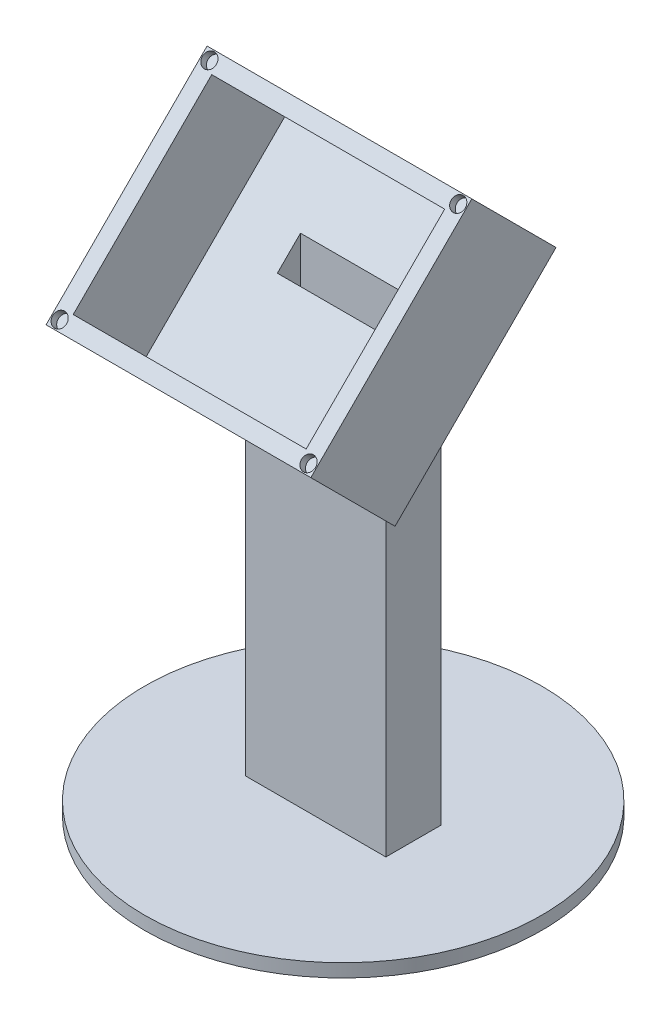
from build123d import *

# Parameters (mm, degrees)
SKETCH1_R           = 75
BOSS_EXTRUDE1_DEPTH = 5
SKETCH2_W           = 53
SKETCH2_H           = 20.734598854
BOSS_EXTRUDE2_DEPTH = 150
BOSS_EXTRUDE3_DEPTH = 53
SKETCH4_W           = 100
SKETCH4_H           = 86
BOSS_EXTRUDE4_DEPTH = 45
SHELL1_START        = -44
SHELL1_DEPTH        = 88
SHELL1_START_2      = -20.5
SHELL1_2_DEPTH      = 41
SKETCH5_W           = 88
SKETCH5_H           = 74
CUT_EXTRUDE1_DEPTH  = 10
SKETCH7_R           = 6
CUT_EXTRUDE2_DEPTH  = 10
SKETCH8_W           = 43
SKETCH8_H           = 15.969997916
CUT_EXTRUDE3_DEPTH  = 10
SKETCH10_R          = 2.65
CUT_EXTRUDE4_DEPTH  = 3
SKETCH12_W          = 15
SKETCH12_H          = 10
CUT_EXTRUDE5_DEPTH  = 10


# Read off the part's stored shape, not the designer's step: Shell1
with BuildPart() as part:
    # Sketch1 → Boss-Extrude1 (new body)
    with BuildSketch(Plane(origin=(0, 0, 0), x_dir=(1, 0, 0), z_dir=(0, 1, 0))):
        with Locations(Location((0, 0, 0), (0, 0, 270))):
            Circle(SKETCH1_R)
    extrude(amount=BOSS_EXTRUDE1_DEPTH)

    # Sketch2 → Boss-Extrude2 (add)
    with BuildSketch(Plane(origin=(0, 5, 0), x_dir=(1, 0, 0), z_dir=(0, 1, 0))):
        Rectangle(SKETCH2_W, SKETCH2_H)
    extrude(amount=BOSS_EXTRUDE2_DEPTH)

    # Sketch3 → Boss-Extrude3 (add)
    with BuildSketch(Plane.ZY.offset(26.5)):
        Polygon((-10.367299427, 155), (-10.367299427, 175.734598855), (10.367299427, 155), align=None)
    extrude(amount=-BOSS_EXTRUDE3_DEPTH)

    # Sketch4 → Boss-Extrude4 (add)
    with BuildSketch(Plane(origin=(0, 82.683649714, 82.683649714), x_dir=(1, 0, 0), z_dir=(0, 0.7071067811865513, 0.7071067811865438))):
        with Locations((0, 116.932338812)):
            Rectangle(SKETCH4_W, SKETCH4_H)
    extrude(amount=BOSS_EXTRUDE4_DEPTH)

    # Shell1 outline → Shell1 (cut)
    with BuildSketch(Plane.YZ.offset(SHELL1_START)):
        Polygon((143.446989211, 30.405591591), (195.772891018, -21.920310217), (219.107414798, 1.414213562), (166.78151299, 53.74011537), align=None)
    extrude(amount=SHELL1_DEPTH, mode=Mode.SUBTRACT)

    # Shell1 2 outline → Shell1 2 (cut)
    with BuildSketch(Plane.YZ.offset(SHELL1_START_2)):
        Polygon((6, 4.367299427), (6, -4.367299427), (178.219880229, -4.367299427), (169.485281374, 4.367299427), align=None)
    extrude(amount=SHELL1_2_DEPTH, mode=Mode.SUBTRACT)

    # Sketch5 → Cut-Extrude1 (cut)
    with BuildSketch(Plane(origin=(0, 114.503454867, 114.503454867), x_dir=(1, 0, 0), z_dir=(0, 0.7071067811865512, 0.7071067811865438))):
        with Locations((0, 116.932338812)):
            Rectangle(SKETCH5_W, SKETCH5_H)
    extrude(amount=-CUT_EXTRUDE1_DEPTH, mode=Mode.SUBTRACT)

    # Sketch7 → Cut-Extrude2 (cut)
    with BuildSketch(Plane(origin=(0, 108.846600618, -108.846600618), x_dir=(1, 0, 0), z_dir=(0, -0.7071067811865438, 0.7071067811865512))):
        with Locations(Location((36.5, 141.33938714, 0), (0, 0, 270))):
            Circle(SKETCH7_R)
    extrude(amount=-CUT_EXTRUDE2_DEPTH, mode=Mode.SUBTRACT)

    # Sketch8 → Cut-Extrude3 (cut)
    with BuildSketch(Plane(origin=(0, 0, -10.367299427), x_dir=(-1, 0, 0), z_dir=(0, 0, -1))):
        with Locations((0, 20.660666548)):
            Rectangle(SKETCH8_W, SKETCH8_H)
    extrude(amount=-CUT_EXTRUDE3_DEPTH, mode=Mode.SUBTRACT)

    # Sketch10 → Cut-Extrude4 (cut)
    with BuildSketch(Plane(origin=(0, 114.503454867, 114.503454867), x_dir=(1, 0, 0), z_dir=(0, 0.7071067811865512, 0.7071067811865438))):
        with Locations(Location((-47, 76.932338812, 0), (0, 0, 270))):
            Circle(SKETCH10_R)
        with Locations(Location((-47, 156.932338812, 0), (0, 0, 270))):
            Circle(SKETCH10_R)
        with Locations(Location((47, 76.932338812, 0), (0, 0, 270))):
            Circle(SKETCH10_R)
        with Locations(Location((47, 156.932338812, 0), (0, 0, 270))):
            Circle(SKETCH10_R)
    extrude(amount=-CUT_EXTRUDE4_DEPTH, mode=Mode.SUBTRACT)

    # Sketch12 → Cut-Extrude5 (cut)
    with BuildSketch(Plane(origin=(0, 108.846600618, -108.846600618), x_dir=(1, 0, 0), z_dir=(0, -0.7071067811865438, 0.7071067811865512))):
        with Locations((-10.5, 151.932338812)):
            Rectangle(SKETCH12_W, SKETCH12_H)
    extrude(amount=-CUT_EXTRUDE5_DEPTH, mode=Mode.SUBTRACT)


solid = part.part
